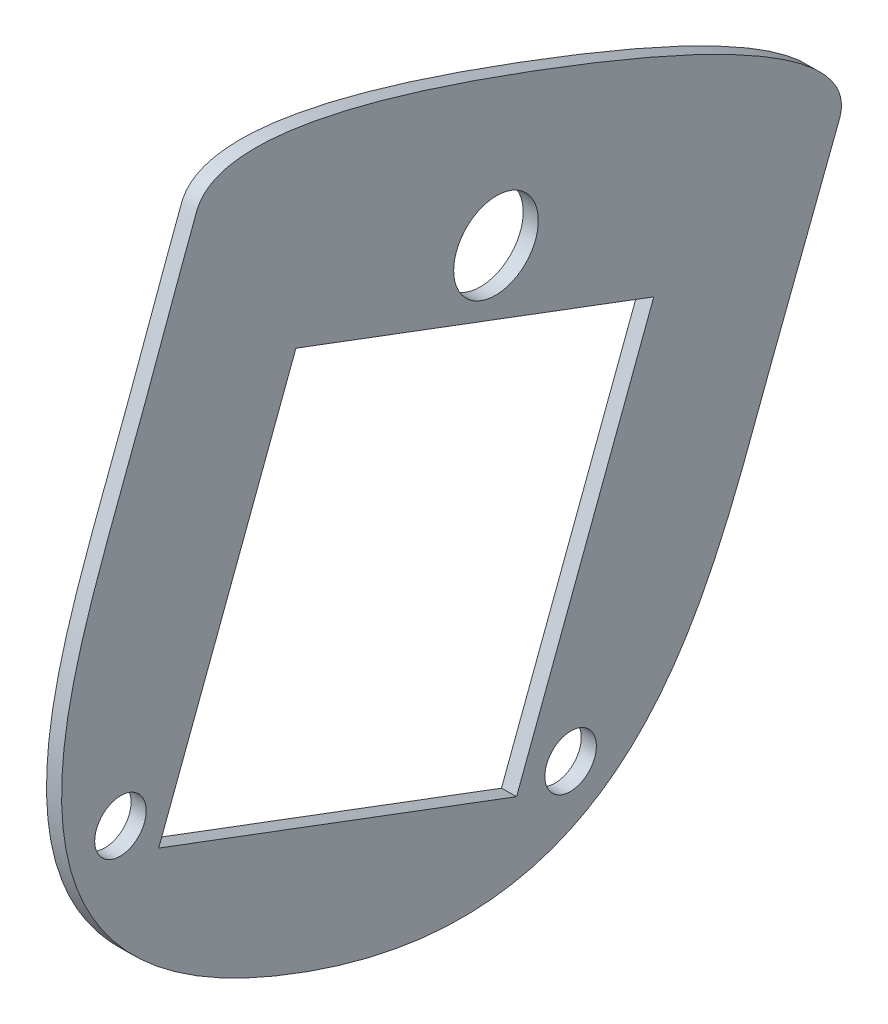
from build123d import *

# Parameters (mm, degrees)
SKETCH3_R           = 11.5
SKETCH3_R_2         = 7
BOSS_EXTRUDE1_DEPTH = 4


with BuildPart() as part:
    # Sketch3 → Boss-Extrude1 (new body)
    with BuildSketch(Plane(origin=(-1179.548631244, -0.000116963, 14.971959902), x_dir=(0.012691934504714668, 1.258519915397729e-09, 0.9999194541554475), z_dir=(-0.9999194541554426, -9.915104323779702e-08, 0.01269193450471473))):
        with BuildLine():
            add(Edge.make_bspline(
                [(84.377905998, 170.073349611), (84.159146209, 170.614103737), (83.611445829, 171.645847401), (82.482488155, 172.968186199), (81.127474205, 174.032815338), (79.625504141, 174.851852168), (78.048065363, 175.46773216), (75.883744714, 176.067351893), (73.137504594, 176.493777281), (69.848329994, 176.668544918), (66.593182125, 176.609478461), (63.378982778, 176.382288344), (60.20731945, 176.028236357), (57.075408808, 175.575862287), (53.980573733, 175.044418403), (50.919287132, 174.448332656), (47.88858994, 173.797522358), (44.885549546, 173.100779506), (40.914701349, 172.117751202), (36.006584389, 170.801928289), (30.186228838, 169.112782921), (24.416677375, 167.331209331), (18.680858867, 165.470954437), (12.962867526, 163.537381585), (7.246752851, 161.536551279), (-0.392782545, 158.779747051), (-6.165961293, 156.613052059), (-13.94829591, 153.628587787), (-19.689671295, 151.379544623), (-27.213353042, 148.32138638), (-32.801411813, 145.987168864), (-38.34590917, 143.60168497), (-43.854658394, 141.149761563), (-49.33590569, 138.616774109), (-54.793159015, 135.98108416), (-59.322515753, 133.677749539), (-62.932447741, 131.753643877), (-65.631328698, 130.263773352), (-68.320076039, 128.721252072), (-70.99499306, 127.117580989), (-73.651650051, 125.443406131), (-76.283024477, 123.685640179), (-78.878235649, 121.828176014), (-81.420273295, 119.847929263), (-83.880369486, 117.71527683), (-86.209443734, 115.385980118), (-87.966528206, 113.232572142), (-89.175083533, 111.339467663), (-89.936337543, 109.826689125), (-90.505629637, 108.213285186), (-90.801403008, 106.515492236), (-90.756707116, 104.777199898), (-90.474046755, 103.643699911), (-90.084384795, 102.569480158), (-89.841034016, 101.911994363), (-89.541465442, 101.124116148), (-89.39022558, 100.730499307), (-89.238048509, 100.337045258), (-89.085953699, 99.943392047), (-88.933536811, 99.549679266), (-88.730132992, 99.024564877), (-88.373481405, 98.105259575), (-87.862190511, 96.790888427), (-87.245924635, 95.211881522), (-86.627148474, 93.631055189), (-86.006043621, 92.048360056), (-85.382804113, 90.46374254), (-84.757617465, 88.87715131), (-84.130649567, 87.288544234), (-83.502064493, 85.697879827), (-82.662014846, 83.574195152), (-81.608733884, 80.914237535), (-80.340964507, 77.713392714), (-79.070680925, 74.503319887), (-77.799405763, 71.283624353), (-76.528661796, 68.053911872), (-75.259433457, 64.814004725), (-73.992705385, 61.563725615), (-72.730871393, 58.302409625), (-71.476325612, 55.029392149), (-69.810026434, 50.651412822), (-67.733040223, 45.155857397), (-65.192889969, 38.548535597), (-63.002092293, 33.047031135), (-61.179682785, 28.661451936), (-60.006324985, 25.929654584), (-59.043849556, 23.751341903), (-58.309275854, 22.121773372), (-57.56111242, 20.496992747), (-56.798597272, 18.877580965), (-56.02074925, 17.264200326), (-55.227016605, 15.657353665), (-54.415921139, 14.057888772), (-52.755061989, 10.875871272), (-50.113640526, 6.170533326), (-46.214055624, 0.106202959), (-41.879815211, -5.682640377), (-37.071022669, -11.095491143), (-31.749304366, -16.030968238), (-26.892659915, -19.643471605), (-22.77171096, -22.182742504), (-18.509010649, -24.473419396), (-12.935749295, -26.848778135), (-5.968718292, -28.897564796), (1.173532604, -30.167771585), (8.394625718, -30.72426012), (15.629246847, -30.639249774), (22.822176795, -29.99272502), (29.944943646, -28.856179071), (36.971413373, -27.310529127), (46.200981004, -24.782274948), (52.958186926, -22.450860484), (61.81972476, -19.052528076), (68.404073328, -16.267470827), (76.95838131, -11.975451151), (83.217088787, -8.426029178), (89.273667966, -4.508006235), (95.054577362, -0.17870119), (100.490854379, 4.595986977), (105.487967549, 9.838586932), (109.949080227, 15.559099084), (113.759190042, 21.741276151), (116.314593096, 27.234185766), (117.952211322, 31.787728825), (119.31821366, 36.431290069), (120.513597166, 42.364707849), (121.170203082, 49.592689871), (121.126324228, 56.832595149), (120.478268293, 64.034720651), (119.322900557, 71.151036814), (118.140760893, 76.415668184), (117.248089102, 79.892054693), (116.781726531, 81.623608795), (116.297499658, 83.349034553), (115.797104501, 85.068701615), (115.281277137, 86.782601375), (114.751194296, 88.490899321), (114.207808244, 90.193672228), (113.466976478, 92.456831493), (112.512877939, 95.2725252), (110.935633256, 99.751829279), (108.886186051, 105.307189462), (106.357132583, 111.918384124), (104.227035857, 117.393292318), (102.538795023, 121.76266191), (101.283192002, 125.035142736), (100.040826281, 128.303809705), (98.809473322, 131.567557235), (97.586908616, 134.825280211), (96.372281382, 138.076452947), (95.164740704, 141.32055023), (93.962890537, 144.556847836), (92.765334624, 147.784622), (91.769947764, 150.466802963), (90.974582637, 152.607652643), (90.37838073, 154.210763325), (89.782350048, 155.811268218), (89.186340893, 157.409088573), (88.590201531, 159.004144829), (87.993758439, 160.596349912), (87.396830825, 162.185613775), (86.799251704, 163.771852109), (86.300563928, 165.091116339), (85.951056972, 166.013206231), (85.751175589, 166.539698033), (85.601252796, 166.934387123), (85.451115071, 167.328812398), (85.301183692, 167.723146525), (85.150455373, 168.116984379), (84.846354037, 168.903163888), (84.587677769, 169.554813042), (84.377905998, 170.073349611)],
                knots=[0, 0, 0, 0, 0.002677759, 0.005355518, 0.008033277, 0.010711036, 0.013388795, 0.016066554, 0.021422071, 0.026777589, 0.032133107, 0.037488625, 0.042844143, 0.048199661, 0.053555179, 0.058910696, 0.064266214, 0.069621732, 0.07497725, 0.085688286, 0.096399321, 0.107110357, 0.117821393, 0.128532429, 0.139243464, 0.1499545, 0.171376571, 0.171376571, 0.192798208, 0.203509027, 0.214219845, 0.224930663, 0.235641482, 0.2463523, 0.257063118, 0.267773937, 0.273129346, 0.278484755, 0.283840164, 0.289195574, 0.294550983, 0.299906392, 0.305261801, 0.31061721, 0.31597262, 0.321328029, 0.326683438, 0.329361143, 0.332038847, 0.334716552, 0.337394256, 0.340071961, 0.342749665, 0.342749665, 0.345316694, 0.345958451, 0.346600208, 0.347241965, 0.347883722, 0.348525479, 0.349167236, 0.350450751, 0.353017779, 0.355584807, 0.358151836, 0.360718864, 0.363285893, 0.365852921, 0.368419949, 0.370986978, 0.373554006, 0.378688063, 0.38382212, 0.388956176, 0.394090233, 0.39922429, 0.404358347, 0.409492403, 0.41462646, 0.419760517, 0.424894574, 0.435162687, 0.445430801, 0.455698914, 0.460832971, 0.465967028, 0.468534056, 0.471101084, 0.473668113, 0.476235141, 0.478802169, 0.481369198, 0.483936226, 0.486503255, 0.496771368, 0.507039482, 0.517307595, 0.527575709, 0.537843822, 0.548111936, 0.553245992, 0.558380049, 0.568648163, 0.578916276, 0.58918439, 0.599452503, 0.609720617, 0.61998873, 0.630256844, 0.640524957, 0.650793071, 0.671329298, 0.671329298, 0.691871217, 0.702142176, 0.712413135, 0.722684095, 0.732955054, 0.743226014, 0.753496973, 0.763767933, 0.774038892, 0.784309852, 0.789445331, 0.794580811, 0.80485177, 0.81512273, 0.825393689, 0.835664649, 0.845935608, 0.856206568, 0.858774308, 0.861342047, 0.863909787, 0.866477527, 0.869045267, 0.871613007, 0.874180747, 0.876748487, 0.881883966, 0.887019446, 0.897290406, 0.907561365, 0.917832324, 0.922967804, 0.928103284, 0.933238764, 0.938374243, 0.943509723, 0.948645203, 0.953780682, 0.958916162, 0.964051642, 0.969187122, 0.971754862, 0.974322601, 0.976890341, 0.979458081, 0.982025821, 0.984593561, 0.987161301, 0.989729041, 0.99229678, 0.99358065, 0.994222585, 0.99486452, 0.995506455, 0.99614839, 0.996790325, 0.99743226, 1, 1, 1, 1], degree=3))
        make_face()
        with Locations((3.088369787, 120.842225121)):
            Circle(SKETCH3_R, mode=Mode.SUBTRACT)
        with Locations((-17.186648299, -9.215855238)):
            Circle(SKETCH3_R_2, mode=Mode.SUBTRACT)
        Polygon((94.736446449, 27.279702875), (-2.498711879, -10.009217528), (-39.787632282, 87.2259408), (57.447526046, 124.514861203), align=None, mode=Mode.SUBTRACT)
        with Locations((105.127599262, 37.690699139)):
            Circle(SKETCH3_R_2, mode=Mode.SUBTRACT)
    extrude(amount=-BOSS_EXTRUDE1_DEPTH)


solid = part.part
